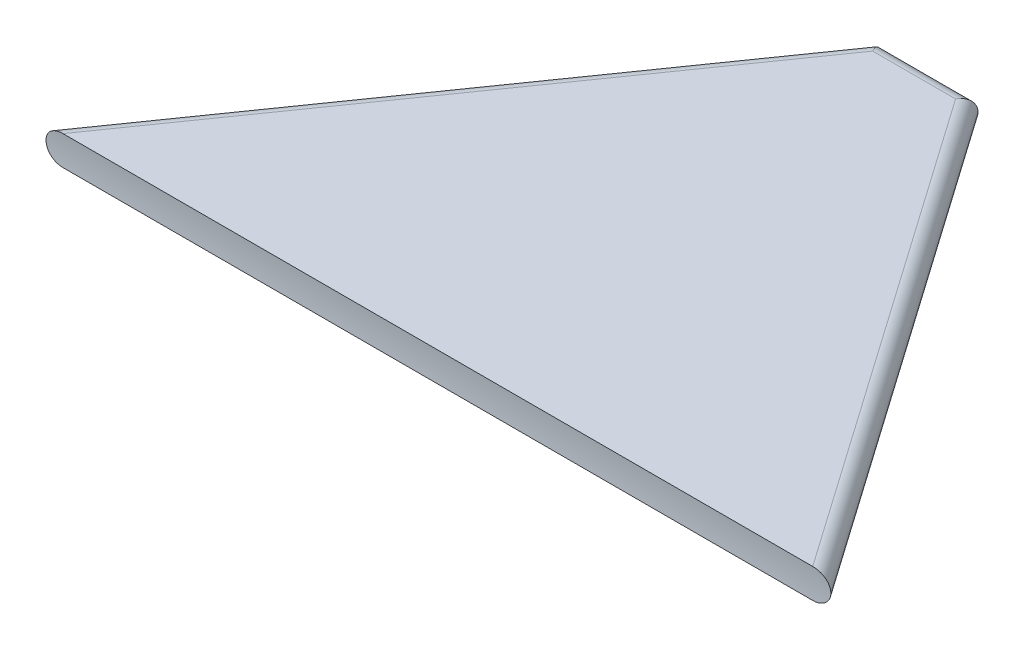
from build123d import *

# Parameters (mm, degrees)
EXTRUDE_1_DEPTH          = 3
FILLET_1_R               = 1.5
CUT_EXTRUDE_1_DEPTH      = 69.078755293
CUT_EXTRUDE_1_DEPTH_BACK = 69.078755293
SKETCH_2_R               = 19


with BuildPart() as part:
    # Эскиз1 → Бобышка-Вытянуть1 (new body)
    with BuildSketch(Plane(origin=(0, 0, 0), x_dir=(1, 0, 0), z_dir=(0, 1, 0))):
        Polygon((-46.105497744, 0), (33.894502256, 0), (-1.105497744, 50), (-11.105497744, 50), align=None)
    extrude(amount=EXTRUDE_1_DEPTH)

    # Скругление1
    fillet_1_edges = [part.edges().sort_by_distance(p)[0] for p in [
        (16.394502256, 0, -25),
        (16.394502256, 3, -25),
        (-28.605497744, 0, -25),
        (-28.605497744, 3, -25),
        (-6.105497744, 0, -50),
        (-6.105497744, 3, -50),
    ]]
    fillet(fillet_1_edges, radius=FILLET_1_R - 0.0001)  # a hair under: the kernel refuses the full size

    # Эскиз2 → Вырез-Вытянуть1 (cut, two sides: drawn at the far end of the back side and taken through both)
    with BuildSketch(Plane(origin=(0, 0, 0), x_dir=(0, 0, -1), z_dir=(1, 0, 0)).offset(-CUT_EXTRUDE_1_DEPTH_BACK)):
        with Locations((-18.940696925, 1.5)):
            Circle(SKETCH_2_R)
    extrude(amount=CUT_EXTRUDE_1_DEPTH + CUT_EXTRUDE_1_DEPTH_BACK, mode=Mode.SUBTRACT)


solid = part.part
